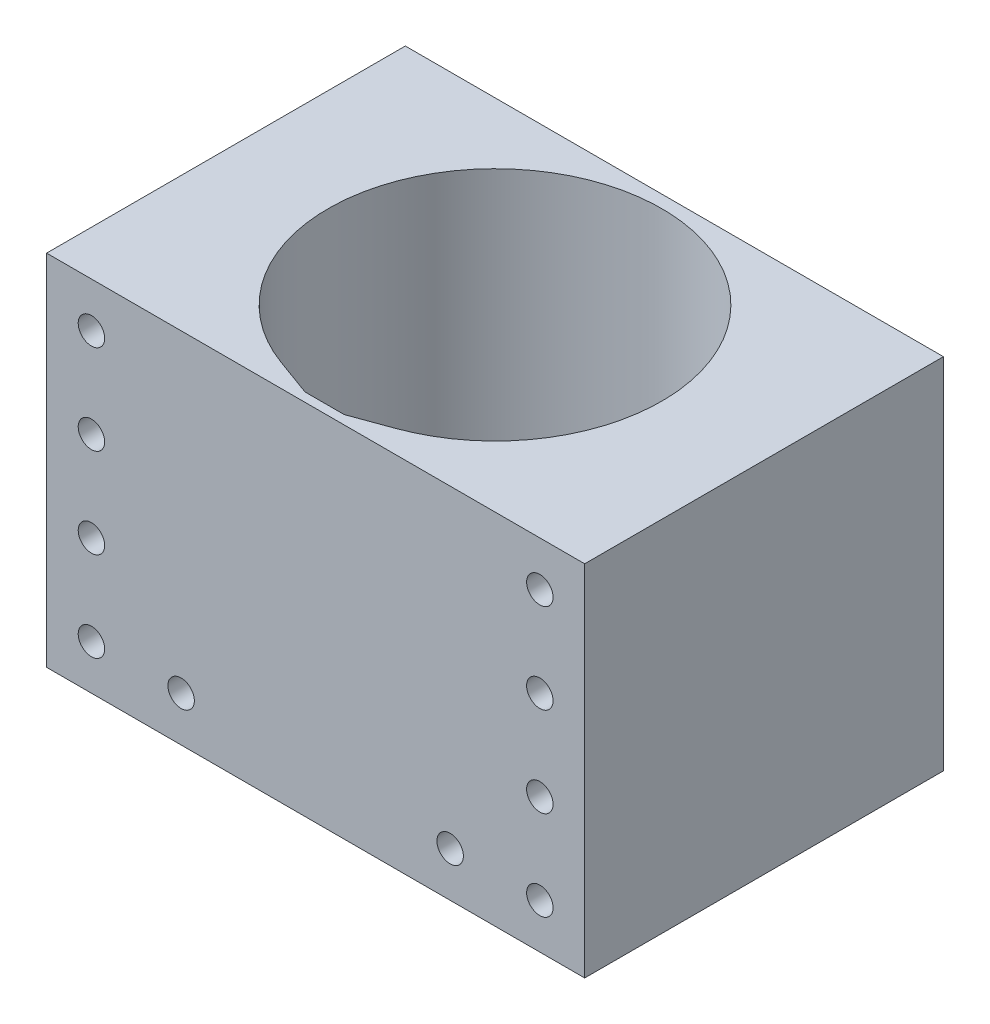
from build123d import *
from build123d.topology import SkipClean

# Parameters (mm, degrees)
SKETCH1_W             = 60
SKETCH1_H             = 40
BOSS_EXTRUDE1_DEPTH   = 40
SKETCH2_R             = 1.475
CUT_EXTRUDE1_DEPTH    = 54.851648071
LPATTERN1_COUNT       = 6
LPATTERN1_PITCH       = 10
LPATTERN1_COUNT_DIR2  = 4
LPATTERN1_PITCH_DIR2  = 10
SKETCH4_R             = 6.1
CUT_EXTRUDE2_DEPTH    = 65.031242374
SKETCH5_R             = 18.6
CUT_EXTRUDE3_DEPTH    = 33
SKETCH6_R             = 1.5
CUT_EXTRUDE4_DEPTH    = 65.031242374
SKETCH7_R             = 3.1
CUT_EXTRUDE5_DEPTH    = 3
CUT_EXTRUDE6_DEPTH    = 0.2
CIRPATTERN1_COUNT     = 6
CUT_EXTRUDE7_DEPTH    = 33
CUT_EXTRUDE8_DEPTH    = 7
BODY_MOVE_COPY1_ANGLE = 90


with BuildPart() as part:
    # Sketch1 → Boss-Extrude1 (new body)
    with BuildSketch(Plane(origin=(0, 0, 0), x_dir=(1, 0, 0), z_dir=(0, 1, 0))):
        Rectangle(SKETCH1_W, SKETCH1_H)
    extrude(amount=BOSS_EXTRUDE1_DEPTH)

    # Sketch2 → Cut-Extrude1 (cut, through all)
    with BuildSketch(Plane.XZ):
        with Locations(Location((-25, 15, 0), (0, 0, 270))):
            Circle(SKETCH2_R)
    cut_extrude1 = extrude(amount=-CUT_EXTRUDE1_DEPTH, mode=Mode.SUBTRACT)

    # LPattern1: Cut-Extrude1 6 × 4, 14 skipped
    with Locations(*[(i * LPATTERN1_PITCH, 0, -j * LPATTERN1_PITCH_DIR2) for i in range(LPATTERN1_COUNT) for j in range(LPATTERN1_COUNT_DIR2) if (i, j) not in ((0, 0), (1, 1), (1, 2), (1, 3), (2, 0), (2, 1), (2, 2), (2, 3), (3, 0), (3, 1), (3, 2), (3, 3), (4, 1), (4, 2), (4, 3))]):
        add(cut_extrude1, mode=Mode.SUBTRACT)

    # Sketch4 → Cut-Extrude2 (cut, through all)
    with BuildSketch(Plane.XY.offset(20)):
        with Locations((0, 13)):
            Circle(SKETCH4_R)
    extrude(amount=-CUT_EXTRUDE2_DEPTH, mode=Mode.SUBTRACT)

    # Sketch5 → Cut-Extrude3 (cut)
    with BuildSketch(Plane(origin=(0, 0, -20), x_dir=(-1, 0, 0), z_dir=(0, 0, -1))):
        with Locations((0, 20)):
            Circle(SKETCH5_R)
    extrude(amount=-CUT_EXTRUDE3_DEPTH, mode=Mode.SUBTRACT)

    # Sketch6 → Cut-Extrude4 (cut, through all)
    with BuildSketch(Plane.XY.offset(20)):
        with Locations((-15.5, 20)):
            Circle(SKETCH6_R)
    cut_extrude4 = extrude(amount=-CUT_EXTRUDE4_DEPTH, mode=Mode.SUBTRACT)

    # Sketch7 → Cut-Extrude5 (cut)
    with BuildSketch(Plane.XY.offset(20)):
        with Locations((-15.5, 20)):
            Circle(SKETCH7_R)
    cut_extrude5 = extrude(amount=-CUT_EXTRUDE5_DEPTH, mode=Mode.SUBTRACT)

    # Sketch9 → Cut-Extrude6 (cut)
    with SkipClean():  # the faces are left unmerged after this step: merging them gives an invalid solid
        with BuildSketch(Plane.XY.offset(17)):
            with BuildLine():
                Line((-18.212931993, 21.5), (-12.787068007, 21.5))
                ThreePointArc((-12.787068007, 21.5), (-12.4, 20), (-12.787068007, 18.5))
                Line((-12.787068007, 18.5), (-18.212931993, 18.5))
                ThreePointArc((-18.212931993, 18.5), (-18.6, 20), (-18.212931993, 21.5))
            make_face()
        cut_extrude6 = extrude(amount=-CUT_EXTRUDE6_DEPTH, mode=Mode.SUBTRACT)

    # CirPattern1: Cut-Extrude4, Cut-Extrude5, Cut-Extrude6 ×6 about axis
    with SkipClean():  # the faces are left unmerged after this step: merging them gives an invalid solid
        cirpattern1_axis = Axis((0, 20, 0), (0, 0, 1))
        add([cut_extrude4.rotate(cirpattern1_axis, i * 360 / CIRPATTERN1_COUNT) for i in range(1, CIRPATTERN1_COUNT)], mode=Mode.SUBTRACT)
        add([cut_extrude5.rotate(cirpattern1_axis, i * 360 / CIRPATTERN1_COUNT) for i in range(1, CIRPATTERN1_COUNT)], mode=Mode.SUBTRACT)
        add([cut_extrude6.rotate(cirpattern1_axis, i * 360 / CIRPATTERN1_COUNT) for i in range(1, CIRPATTERN1_COUNT)], mode=Mode.SUBTRACT)

    # Sketch10 → Cut-Extrude7 (cut)
    with BuildSketch(Plane(origin=(0, 0, -20), x_dir=(-1, 0, 0), z_dir=(0, 0, -1))):
        Polygon((-6.361574666, 37.478282747), (-2.180690873, 39), (2.180690873, 39), (6.361574666, 37.478282747), align=None)
    extrude(amount=-CUT_EXTRUDE7_DEPTH, mode=Mode.SUBTRACT)

    # Sketch11 → Cut-Extrude8 (cut)
    with BuildSketch(Plane(origin=(0, 0, 13), x_dir=(-1, 0, 0), z_dir=(0, 0, -1))):
        Polygon((-2.086322874, 18.732124987), (-0.526099098, 19.3), (0.526099098, 19.3), (2.086322874, 18.732124987), align=None)
    extrude(amount=-CUT_EXTRUDE8_DEPTH, mode=Mode.SUBTRACT)


with BuildPart() as part_1:
    # Body-Move/Copy1: read off the stored shape, not the designer's step
    # Body-Move/Copy1: moved
    add(part.part.rotate(Axis((0, 0, 0), (1, 0, 0)), BODY_MOVE_COPY1_ANGLE))


solid = part_1.part
